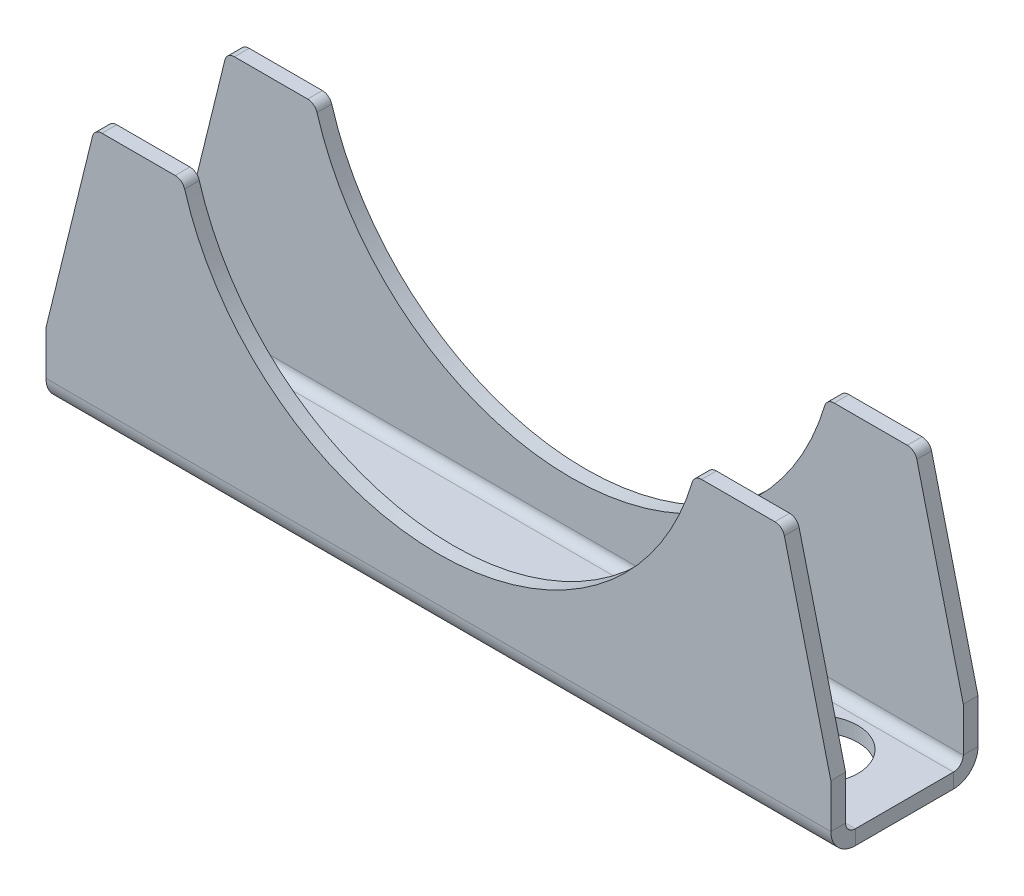
from build123d import *

# Parameters (mm, degrees)
SM_BASE_FLANGE_1_DEPTH = 80
CUT_EXTRUDE_1_DEPTH    = 35
FILLET_1_R             = 1
EXTRUDE_START          = -1.5
EXTRUDE_1_OUTLINE_R    = 4.25
EXTRUDE_1_DEPTH        = 1.5


# Read off the part's stored shape, not the designer's step: Бобышка-Вытянуть1
# Sheet-metal steps are written as plain solids
with BuildPart() as part:
    # Sketch 1 → Базовая кромка1 (new body)
    with BuildSketch(Plane(origin=(0, 0, 0), x_dir=(0, 0, -1), z_dir=(1, 0, 0))):
        with BuildLine():
            Line((-6, 25.5), (-6, 1))
            ThreePointArc((-6, 1), (-5.707106781, 0.292893219), (-5, 0))
            Line((-5, 0), (5, 0))
            ThreePointArc((5, 0), (5.707106781, 0.292893219), (6, 1))
            Line((6, 1), (6, 25.5))
            Line((6, 25.5), (7.5, 25.5))
            Line((7.5, 25.5), (7.5, 1))
            ThreePointArc((7.5, 1), (6.767766953, -0.767766953), (5, -1.5))
            Line((5, -1.5), (-5, -1.5))
            ThreePointArc((-5, -1.5), (-6.767766953, -0.767766953), (-7.5, 1))
            Line((-7.5, 1), (-7.5, 25.5))
            Line((-7.5, 25.5), (-6, 25.5))
        make_face()
    extrude(amount=SM_BASE_FLANGE_1_DEPTH)

    # Эскиз6 → Вырез-Вытянуть1 (cut)
    with BuildSketch(Plane.XY.offset(7.5)):
        Polygon((80, 25.5), (75.076809621, 25.5), (80, 5.5), align=None)
        with BuildLine():
            ThreePointArc((13.923190379, 25.5), (23.568323275, 11.075714714), (40, 5.5))
            Line((40, 5.5), (40, 25.5))
            Line((40, 25.5), (13.923190379, 25.5))
        make_face()
        with BuildLine():
            Line((40, 25.5), (40, 5.5))
            ThreePointArc((40, 5.5), (56.431676725, 11.075714714), (66.076809621, 25.5))
            Line((66.076809621, 25.5), (40, 25.5))
        make_face()
        Polygon((0, 5.5), (4.923190379, 25.5), (0, 25.5), align=None)
    extrude(amount=-CUT_EXTRUDE_1_DEPTH, mode=Mode.SUBTRACT)

    # Скругление1
    fillet_1_edges = [part.edges().sort_by_distance(p)[0] for p in [
        (75.076809621, 25.5, -6.75),
        (75.076809621, 25.5, 6.75),
        (13.923190379, 25.5, -6.75),
        (66.076809621, 25.5, -6.75),
        (13.923190379, 25.5, 6.75),
        (66.076809621, 25.5, 6.75),
        (4.923190379, 25.5, -6.75),
        (4.923190379, 25.5, 6.75),
    ]]
    fillet(fillet_1_edges, radius=FILLET_1_R)

    # Бобышка-Вытянуть1 outline → Бобышка-Вытянуть1 (cut)
    with BuildSketch(Plane.XZ.offset(1.5).offset(EXTRUDE_START)):
        with Locations((71, 0)):
            Circle(EXTRUDE_1_OUTLINE_R)
        with Locations((9, 0)):
            Circle(EXTRUDE_1_OUTLINE_R)
    extrude(amount=EXTRUDE_1_DEPTH, mode=Mode.SUBTRACT)


solid = part.part
